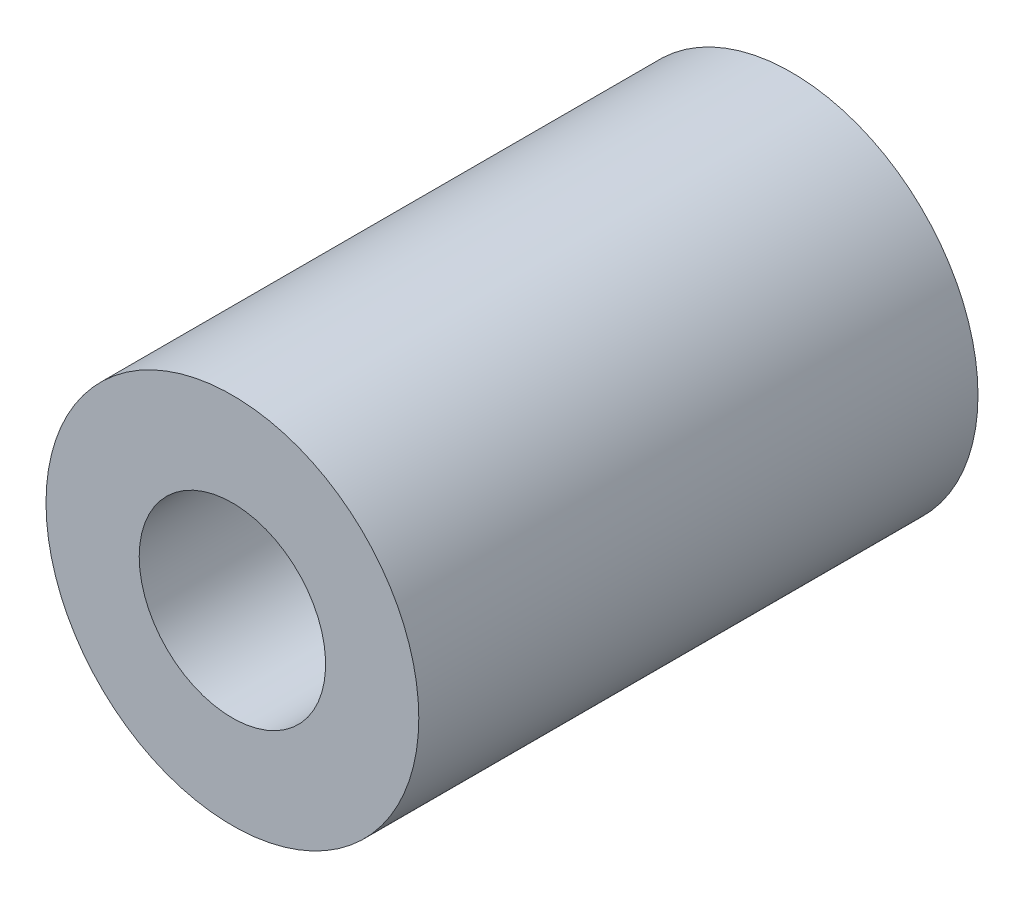
from build123d import *

# Parameters (mm, degrees)
SKETCH1_R           = 6.35
SKETCH1_R_2         = 3.175
BOSS_EXTRUDE1_DEPTH = 9.525


with BuildPart() as part:
    # Sketch1 → Boss-Extrude1 (new, symmetric)
    with BuildSketch(Plane.XY):
        Circle(SKETCH1_R)
        Circle(SKETCH1_R_2, mode=Mode.SUBTRACT)
    extrude(amount=BOSS_EXTRUDE1_DEPTH, both=True)


solid = part.part
